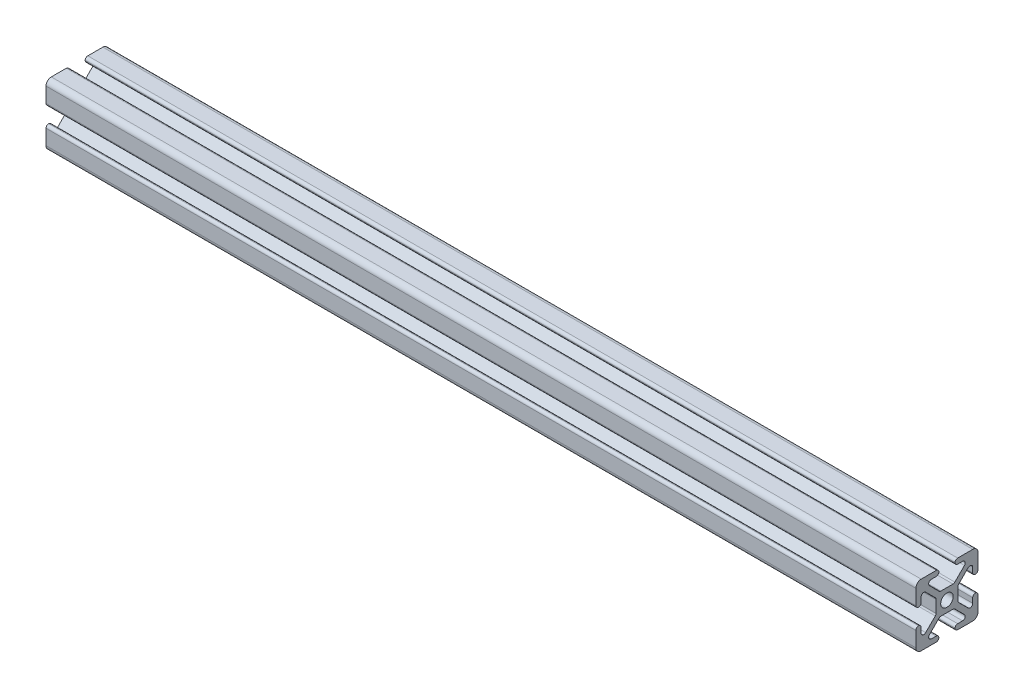
from build123d import *

# Parameters (mm, degrees)
SKETCH1_R           = 2.5
BOSS_EXTRUDE1_DEPTH = 350
FILLET1_R           = 1.065
FILLET2_R           = 2.13


with BuildPart() as part:
    # Sketch1 → Boss-Extrude1 (new body)
    with BuildSketch(Plane.YZ):
        Polygon((-12.5, -3.25), (-12.5, -12.5), (-3.25, -12.5), (-3.25, -10.37), (-8.863862556, -10.37), (-2.873862556, -4.38), (2.873862556, -4.38), (8.863862556, -10.37), (3.25, -10.37), (3.25, -12.5), (12.5, -12.5), (12.5, -3.25), (10.37, -3.25), (10.37, -8.863862556), (4.38, -2.873862556), (4.38, 2.873862556), (10.37, 8.863862556), (10.37, 3.25), (12.5, 3.25), (12.5, 12.5), (3.25, 12.5), (3.25, 10.37), (8.863862556, 10.37), (2.873862556, 4.38), (-2.873862556, 4.38), (-8.863862556, 10.37), (-3.25, 10.37), (-3.25, 12.5), (-12.5, 12.5), (-12.5, 3.25), (-10.37, 3.25), (-10.37, 8.863862556), (-4.38, 2.873862556), (-4.38, -2.873862556), (-10.37, -8.863862556), (-10.37, -3.25), align=None)
        with Locations(Location((0, 0, 0), (0, 0, 270))):
            Circle(SKETCH1_R, mode=Mode.SUBTRACT)
    extrude(amount=BOSS_EXTRUDE1_DEPTH)

    # Fillet1
    fillet1_edges = [part.edges().sort_by_distance(p)[0] for p in [
        (175, -10.37, -8.863862556),
        (175, 2.873862556, -4.38),
        (175, -2.873862556, -4.38),
        (175, -4.38, 2.873862556),
        (175, -4.38, -2.873862556),
        (175, -2.873862556, 4.38),
        (175, 2.873862556, 4.38),
        (175, 4.38, 2.873862556),
        (175, 4.38, -2.873862556),
        (175, -8.863862556, -10.37),
        (175, 8.863862556, -10.37),
        (175, 10.37, -8.863862556),
        (175, -10.37, 8.863862556),
        (175, -8.863862556, 10.37),
        (175, 10.37, 8.863862556),
        (175, 8.863862556, 10.37),
        (175, 12.5, 3.25),
        (175, -3.25, -12.5),
        (175, -10.37, 3.25),
        (175, 10.37, 3.25),
        (175, -10.37, -3.25),
        (175, -12.5, -3.25),
        (175, -12.5, 3.25),
        (175, 3.25, -10.37),
        (175, -3.25, -10.37),
        (175, 3.25, -12.5),
        (175, 10.37, -3.25),
        (175, 12.5, -3.25),
        (175, 3.25, 12.5),
        (175, 3.25, 10.37),
        (175, -3.25, 10.37),
        (175, -3.25, 12.5),
    ]]
    fillet(fillet1_edges, radius=FILLET1_R - 0.0001)  # a hair under: the kernel refuses the full size

    # Fillet2
    fillet2_edges = [part.edges().sort_by_distance(p)[0] for p in [
        (175, -12.5, 12.5),
        (175, 12.5, 12.5),
        (175, 12.5, -12.5),
        (175, -12.5, -12.5),
    ]]
    fillet(fillet2_edges, radius=FILLET2_R)


solid = part.part
